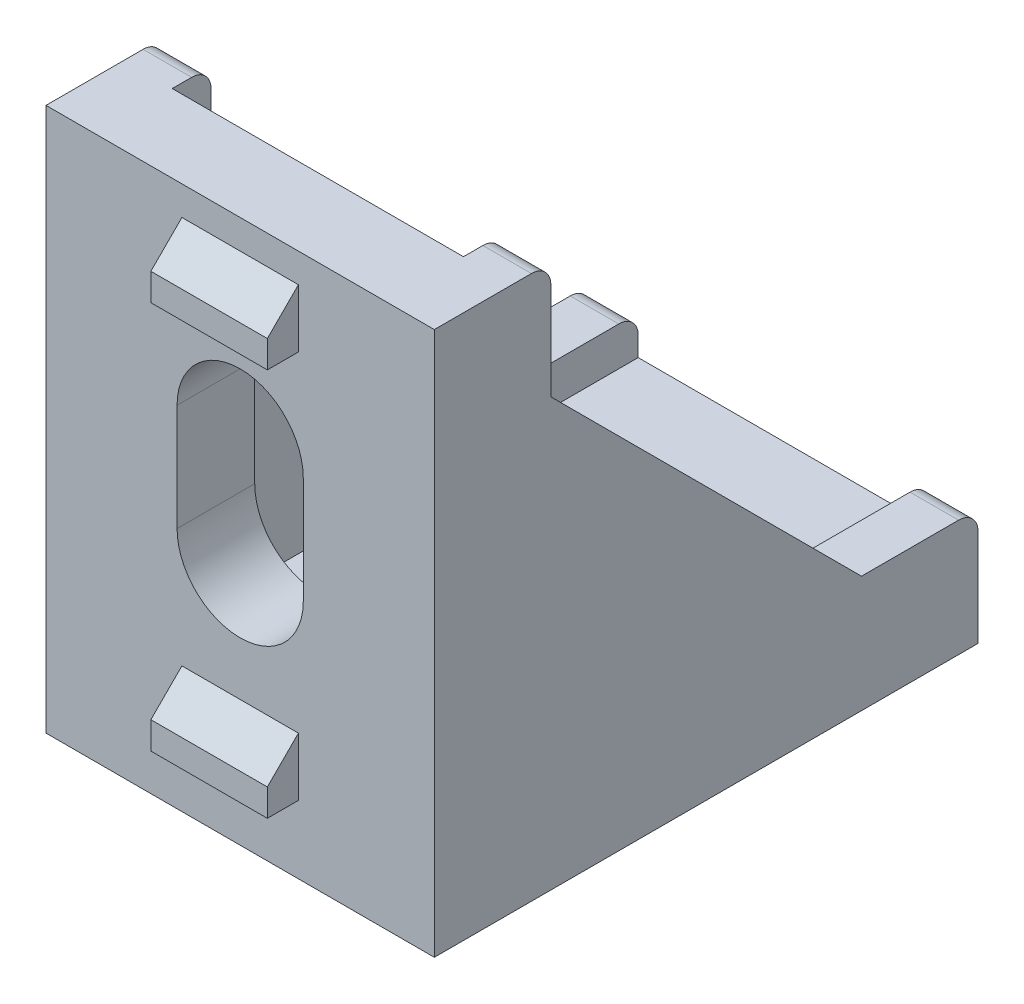
from build123d import *

# Parameters (mm, degrees)
SKETCH1_W           = 17.5
SKETCH1_H           = 16
BOSS_EXTRUDE1_DEPTH = 6
SKETCH2_W           = 2.5
SKETCH2_H           = 16
BOSS_EXTRUDE2_DEPTH = 22
BOSS_EXTRUDE3_DEPTH = 2.5
BOSS_EXTRUDE4_DEPTH = 6
SKETCH5_W           = 20
SKETCH5_H           = 28
BOSS_EXTRUDE5_DEPTH = 6
CUT_EXTRUDE1_REACH  = 40.21
SKETCH7_W           = 15
SKETCH7_H           = 22
CUT_EXTRUDE2_REACH  = 40.21
SKETCH9_W           = 15
SKETCH9_H           = 24
CUT_EXTRUDE3_DEPTH  = 45.362146026
CUT_EXTRUDE4_DEPTH  = 39.209946349
CUT_EXTRUDE5_DEPTH  = 41.841155713
BOSS_EXTRUDE6_DEPTH = 6
BOSS_EXTRUDE7_DEPTH = 6
BOSS_EXTRUDE8_DEPTH = 6
BOSS_EXTRUDE9_DEPTH = 6
FILLET1_R           = 1


with BuildPart() as part:
    # Sketch1 → Boss-Extrude1 (new body)
    with BuildSketch(Plane.XY):
        with Locations((-1.25, 14)):
            Rectangle(SKETCH1_W, SKETCH1_H)
    extrude(amount=-BOSS_EXTRUDE1_DEPTH)

    # Sketch2 → Boss-Extrude2 (add)
    with BuildSketch(Plane(origin=(0, 0, -6), x_dir=(-1, 0, 0), z_dir=(0, 0, -1))):
        with Locations((8.75, 14)):
            Rectangle(SKETCH2_W, SKETCH2_H)
    extrude(amount=BOSS_EXTRUDE2_DEPTH)

    # Sketch3 → Boss-Extrude3 (add)
    with BuildSketch(Plane(origin=(7.5, 0, 0), x_dir=(0, 0, -1), z_dir=(1, 0, 0))):
        Polygon((6, 22), (22, 6), (0, 6), (0, 22), align=None)
    extrude(amount=BOSS_EXTRUDE3_DEPTH)

    # Sketch4 → Boss-Extrude4 (add)
    with BuildSketch(Plane(origin=(0, 22, 0), x_dir=(-1, 0, 0), z_dir=(0, 1, 0))):
        Polygon((7.5, -6), (-10, -6), (-10, 0), (10, 0), (10, -28), (7.5, -28), align=None)
    extrude(amount=BOSS_EXTRUDE4_DEPTH)

    # Sketch5 → Boss-Extrude5 (add)
    with BuildSketch(Plane.XZ.offset(-6)):
        with Locations((0, -14)):
            Rectangle(SKETCH5_W, SKETCH5_H)
    extrude(amount=BOSS_EXTRUDE5_DEPTH)

    # Sketch7 → Cut-Extrude1 (cut, up to next)
    with BuildSketch(Plane.XY.offset(-4), mode=Mode.PRIVATE) as cut_extrude1_sk1:
        with Locations((0, 17)):
            Rectangle(SKETCH7_W, SKETCH7_H)
    cut_extrude1_tool1 = extrude(cut_extrude1_sk1.sketch, amount=-CUT_EXTRUDE1_REACH, mode=Mode.PRIVATE) & part.part
    add(cut_extrude1_tool1.solids().sort_by_distance((0, 17, -4))[0], mode=Mode.SUBTRACT)

    # Sketch9 → Cut-Extrude2 (cut, up to next)
    with BuildSketch(Plane.XZ.offset(-4), mode=Mode.PRIVATE) as cut_extrude2_sk1:
        with Locations((0, -16)):
            Rectangle(SKETCH9_W, SKETCH9_H)
    cut_extrude2_tool1 = extrude(cut_extrude2_sk1.sketch, amount=-CUT_EXTRUDE2_REACH, mode=Mode.PRIVATE) & part.part
    add(cut_extrude2_tool1.solids().sort_by_distance((0, 4, -16))[0], mode=Mode.SUBTRACT)

    # Sketch10 → Cut-Extrude3 (cut, through all)
    with BuildSketch(Plane.ZY.offset(10)):
        Polygon((-28, 28), (-28, 6), (-22, 6), (-6, 22), (-6, 28), align=None)
    extrude(amount=-CUT_EXTRUDE3_DEPTH, mode=Mode.SUBTRACT)

    # Sketch11 → Cut-Extrude4 (cut, through all)
    with BuildSketch(Plane(origin=(0, 0, -4), x_dir=(-1, 0, 0), z_dir=(0, 0, -1))):
        with BuildLine():
            Line((3.25, 12.5), (3.25, 18))
            ThreePointArc((3.25, 18), (0, 21.25), (-3.25, 18))
            Line((-3.25, 18), (-3.25, 12.5))
            ThreePointArc((-3.25, 12.5), (0, 9.25), (3.25, 12.5))
        make_face()
    extrude(amount=-CUT_EXTRUDE4_DEPTH, mode=Mode.SUBTRACT)

    # Sketch12 → Cut-Extrude5 (cut, through all)
    with BuildSketch(Plane.XZ):
        with BuildLine():
            Line((3.25, -18), (3.25, -12.5))
            ThreePointArc((3.25, -12.5), (0, -9.25), (-3.25, -12.5))
            Line((-3.25, -12.5), (-3.25, -18))
            ThreePointArc((-3.25, -18), (0, -21.25), (3.25, -18))
        make_face()
    extrude(amount=-CUT_EXTRUDE5_DEPTH, mode=Mode.SUBTRACT)

    # Sketch13 → Boss-Extrude6 (add)
    with BuildSketch(Plane(origin=(3, 0, 0), x_dir=(0, 0, -1), z_dir=(1, 0, 0))):
        Polygon((0, 26.5), (-1.6, 24.9), (-1.6, 23.5), (0, 23.5), align=None)
    extrude(amount=-BOSS_EXTRUDE6_DEPTH)

    # Sketch14 → Boss-Extrude7 (add)
    with BuildSketch(Plane(origin=(3, 0, 0), x_dir=(0, 0, -1), z_dir=(1, 0, 0))):
        Polygon((0, 6.5), (-1.6, 4.9), (-1.6, 3.5), (0, 3.5), align=None)
    extrude(amount=-BOSS_EXTRUDE7_DEPTH)

    # Sketch15 → Boss-Extrude8 (add)
    with BuildSketch(Plane(origin=(3, 0, 0), x_dir=(0, 0, -1), z_dir=(1, 0, 0))):
        Polygon((23.5, 0), (23.5, -1.6), (24.9, -1.6), (26.5, 0), align=None)
    extrude(amount=-BOSS_EXTRUDE8_DEPTH)

    # Sketch16 → Boss-Extrude9 (add)
    with BuildSketch(Plane(origin=(3, 0, 0), x_dir=(0, 0, -1), z_dir=(1, 0, 0))):
        Polygon((3.5, 0), (3.5, -1.6), (4.9, -1.6), (6.5, 0), align=None)
    extrude(amount=-BOSS_EXTRUDE9_DEPTH)

    # Fillet1
    fillet1_edges = [part.edges().sort_by_distance(p)[0] for p in [
        (-8.75, 6, -28),
        (8.75, 6, -28),
        (-8.75, 28, -6),
        (8.75, 28, -6),
    ]]
    fillet(fillet1_edges, radius=FILLET1_R)


solid = part.part
